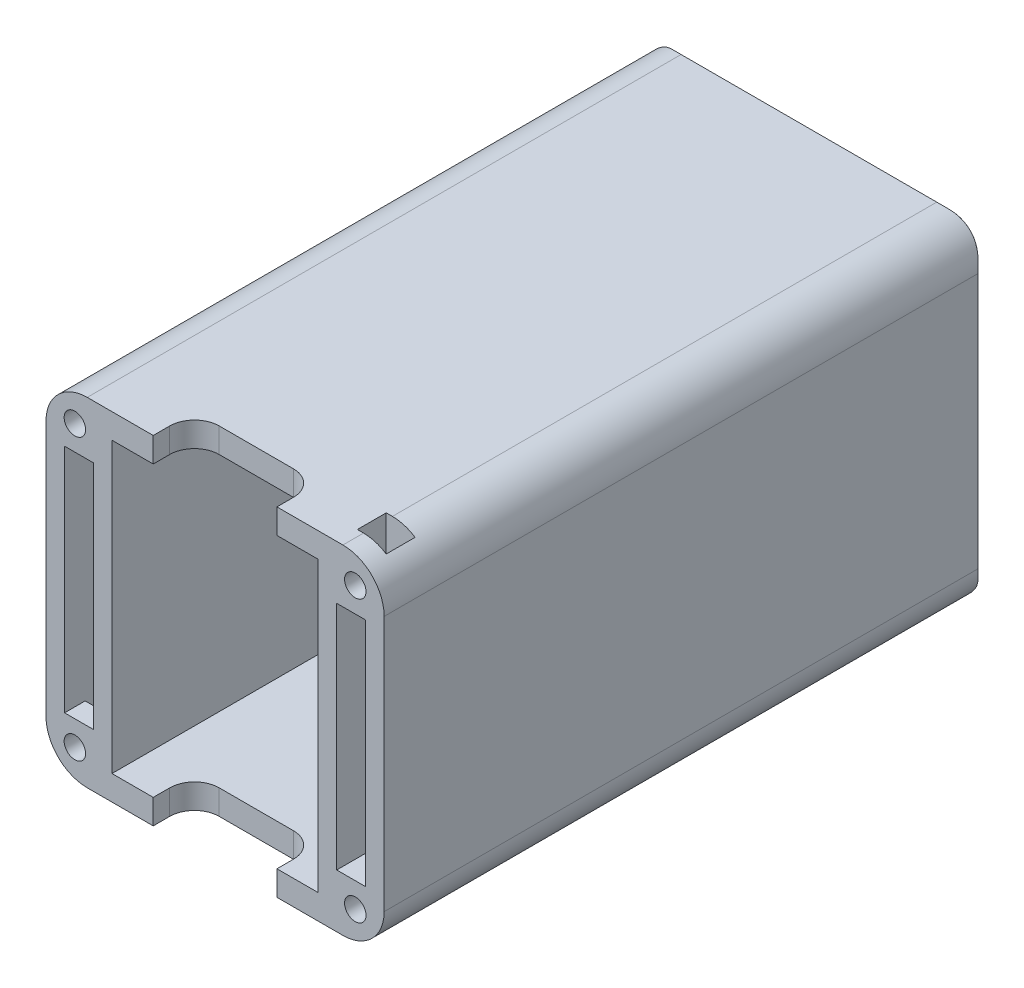
from build123d import *

# Parameters (mm, degrees)
SKETCH_1_W             = 41
SKETCH_1_H             = 41
SKETCH_1_W_2           = 25
SKETCH_1_H_2           = 35
EXTRUDE_1_DEPTH        = 72
SKETCH_2_W             = 41
SKETCH_2_H             = 41
EXTRUDE_2_DEPTH        = 3
CHAMFER_1_SIZE         = 3
FILLET_1_R             = 5
SKETCH_3_W             = 15
SKETCH_3_H             = 3
CUT_EXTRUDE_1_DEPTH    = 5
FILLET_2_R             = 3
SKETCH_4_W             = 3.5
SKETCH_4_H             = 28
CUT_EXTRUDE_2_DEPTH    = 6
SKETCH_6_W             = 3.5
SKETCH_6_H             = 3.5
CUT_EXTRUDE_4_DEPTH    = 83.428757118
SKETCH_7_W             = 3.5
SKETCH_7_H             = 3.5
CUT_EXTRUDE_5_DEPTH    = 83.428757118
FILLET_2_OF_MIRROR_1_R = 3
SKETCH_8_R             = 1.3
CUT_EXTRUDE_6_DEPTH    = 2.5


with BuildPart() as part:
    # ｽｹｯﾁ1 → ﾎﾞｽ - 押し出し1 (new body)
    with BuildSketch(Plane.XY):
        Rectangle(SKETCH_1_W, SKETCH_1_H)
        Rectangle(SKETCH_1_W_2, SKETCH_1_H_2, mode=Mode.SUBTRACT)
    extrude(amount=EXTRUDE_1_DEPTH)

    # ｽｹｯﾁ2 → ﾎﾞｽ - 押し出し2 (add)
    with BuildSketch(Plane(origin=(0, 0, 0), x_dir=(-1, 0, 0), z_dir=(0, 0, -1))):
        Rectangle(SKETCH_2_W, SKETCH_2_H)
    extrude(amount=EXTRUDE_2_DEPTH)

    # 面取り1
    chamfer_1_edges = [part.edges().sort_by_distance(p)[0] for p in [
        (20.5, 0, -3),
        (0, -20.5, -3),
        (-20.5, 0, -3),
        (0, 20.5, -3),
    ]]
    chamfer(chamfer_1_edges, length=CHAMFER_1_SIZE)

    # ﾌｨﾚｯﾄ1
    # the kernel refuses this fillet: 5 mm, written as the material it takes off along each edge
    with BuildSketch(Plane(origin=(-20.5, 20.5, 84.5), x_dir=(0, -1, 0), z_dir=(0, 0, -1)), Plane(origin=(20.5, 20.5, -12.5), x_dir=(0, -1, 0), z_dir=(0, 0, 1)), Plane(origin=(20.5, -20.5, -12.5), x_dir=(-1, 0, 0), z_dir=(0, 0, 1)), Plane(origin=(-20.5, -20.5, 84.5), x_dir=(1, 0, 0), z_dir=(0, 0, -1))) as fillet_1_piece_1:
        with BuildLine():
            CenterArc((FILLET_1_R, -FILLET_1_R), FILLET_1_R, 90, 90)
            Line((0, -FILLET_1_R), (0, 0))
            Line((0, 0), (FILLET_1_R, 0))
        make_face()
    extrude(amount=97, mode=Mode.SUBTRACT)
    with BuildSketch(Plane(origin=(-24.666666667, -24.666666667, 4.166666667), x_dir=(0.816496580927726, -0.40824829046386285, 0.4082482904638632), z_dir=(0.5773502691896258, 0.5773502691896258, -0.5773502691896258))) as fillet_1_piece_2:
        with BuildLine():
            CenterArc((FILLET_1_R * 0.57735026919, -FILLET_1_R), FILLET_1_R, 90, 60)
            Line((-FILLET_1_R * 0.288675134595, -FILLET_1_R * 0.5), (0, 0))
            Line((0, 0), (FILLET_1_R * 0.57735026919, 0))
        make_face()
    extrude(amount=19.629909152, mode=Mode.SUBTRACT)
    with BuildSketch(Plane(origin=(24.666666667, -24.666666667, 4.166666667), x_dir=(-0.816496580927726, -0.40824829046386285, 0.4082482904638632), z_dir=(-0.5773502691896258, 0.5773502691896258, -0.5773502691896258)), Plane(origin=(-13.333333333, 13.333333333, -7.166666667), x_dir=(-0.40824829046386285, -0.816496580927726, 0.4082482904638632), z_dir=(-0.5773502691896258, 0.5773502691896258, 0.5773502691896258)), Plane(origin=(24.666666667, 24.666666667, 4.166666667), x_dir=(0.40824829046386285, -0.816496580927726, 0.4082482904638632), z_dir=(-0.5773502691896258, -0.5773502691896258, -0.5773502691896258))) as fillet_1_piece_3:
        with BuildLine():
            CenterArc((FILLET_1_R * 0.57735026919, FILLET_1_R), FILLET_1_R, 210, 60)
            Line((-FILLET_1_R * 0.288675134595, FILLET_1_R * 0.5), (0, 0))
            Line((0, 0), (FILLET_1_R * 0.57735026919, 0))
        make_face()
    extrude(amount=19.629909152, mode=Mode.SUBTRACT)

    # ｽｹｯﾁ3 → ｶｯﾄ - 押し出し1 (cut)
    with BuildSketch(Plane.XY.offset(72)):
        with Locations((0, 19)):
            Rectangle(SKETCH_3_W, SKETCH_3_H)
    cut_extrude_1 = extrude(amount=-CUT_EXTRUDE_1_DEPTH, mode=Mode.SUBTRACT)

    # ﾌｨﾚｯﾄ2
    fillet_2_edges = [part.edges().sort_by_distance(p)[0] for p in [
        (-7.5, 19, 67),
        (7.5, 19, 67),
    ]]
    fillet(fillet_2_edges, radius=FILLET_2_R)

    # ｽｹｯﾁ4 → ｶｯﾄ - 押し出し2 (cut)
    with BuildSketch(Plane.XY.offset(72)):
        with Locations((-16.5, 0)):
            Rectangle(SKETCH_4_W, SKETCH_4_H)
        with Locations((16.5, 0)):
            Rectangle(SKETCH_4_W, SKETCH_4_H)
    extrude(amount=-CUT_EXTRUDE_2_DEPTH, mode=Mode.SUBTRACT)

    # ｽｹｯﾁ6 → ｶｯﾄ - 押し出し4 (cut, through all)
    with BuildSketch(Plane.XZ.offset(-14)):
        with Locations((16.5, 67.75)):
            Rectangle(SKETCH_6_W, SKETCH_6_H)
    extrude(amount=-CUT_EXTRUDE_4_DEPTH, mode=Mode.SUBTRACT)

    # ｽｹｯﾁ7 → ｶｯﾄ - 押し出し5 (cut, through all)
    with BuildSketch(Plane(origin=(0, -14, 0), x_dir=(1, 0, 0), z_dir=(0, 1, 0))):
        with Locations((-16.5, -67.75)):
            Rectangle(SKETCH_7_W, SKETCH_7_H)
    extrude(amount=-CUT_EXTRUDE_5_DEPTH, mode=Mode.SUBTRACT)

    # ﾐﾗｰ1: ｶｯﾄ - 押し出し1 across plane
    add(cut_extrude_1.mirror(Plane.ZX), mode=Mode.SUBTRACT)

    # ﾌｨﾚｯﾄ2 of ﾐﾗｰ1
    fillet_2_of_mirror_1_edges = [part.edges().sort_by_distance(p)[0] for p in [
        (-7.5, -19, 67),
        (7.5, -19, 67),
    ]]
    fillet(fillet_2_of_mirror_1_edges, radius=FILLET_2_OF_MIRROR_1_R)

    # ｽｹｯﾁ8 → ｶｯﾄ - 押し出し6 (cut)
    with BuildSketch(Plane.XY.offset(72)):
        with Locations((17, 17)):
            Circle(SKETCH_8_R)
        with Locations((17, -17)):
            Circle(SKETCH_8_R)
        with Locations((-17, -17)):
            Circle(SKETCH_8_R)
        with Locations((-17, 17)):
            Circle(SKETCH_8_R)
    extrude(amount=-CUT_EXTRUDE_6_DEPTH, mode=Mode.SUBTRACT)


solid = part.part
